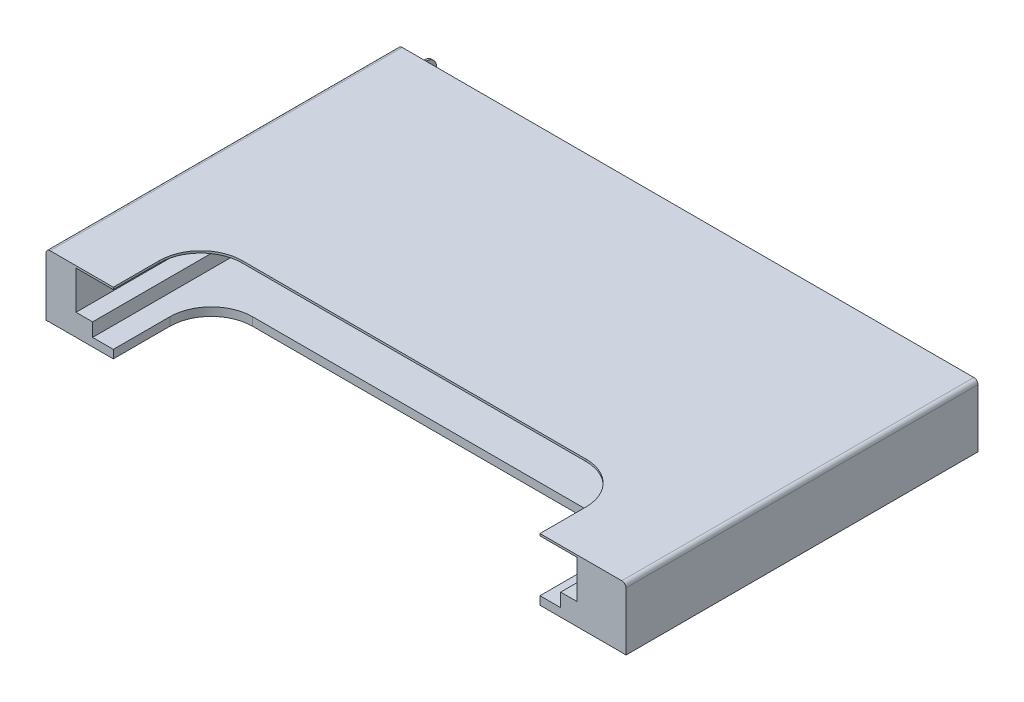
from build123d import *

# Parameters (mm, degrees)
SKETCH_5_W                          = 27.8
SKETCH_5_H                          = 2.9
EXTRUDE_2832_DEPTH                  = 29.2
CUT_EXTRUDE_3391_DEPTH              = 28
CUT_EXTRUDE_4027_DEPTH              = 0.5
SKETCH_41_W                         = 1.1
SKETCH_41_H                         = 2.9
CUT_EXTRUDE_4512_DEPTH              = 0.1
SKETCH_42_W                         = 1.1
SKETCH_42_H                         = 0.9
CUT_EXTRUDE_4964_DEPTH              = 0.1
SKETCH_13_R                         = 0.75
EXTRUDE_5511_DEPTH                  = 0.8
SKETCH_72_W                         = 1.1
SKETCH_72_H                         = 2.9
CUT_EXTRUDE_10_DEPTH                = 0.1
SKETCH_73_W                         = 0.8
SKETCH_73_H                         = 1.1
CUT_EXTRUDE_11_DEPTH                = 0.1
EXTRUDE_14_DEPTH                    = 0.5
EXTRUDE_14_DEPTH_BACK               = 0.5
SKETCH_74_W                         = 0.5
SKETCH_74_H                         = 1
FILLET_1_R                          = 0.3
CHAMFER_1_SIZE                      = 0.5
CHAMFER_2_SIZE                      = 0.35
CHAMFER_7286_SIZE                   = 0.3
SKETCH_30_W                         = 27.8
SKETCH_30_H                         = 27.01
SM_BASE_FLANGE_7820_DEPTH           = 0.1
SM_EDGE_FLANGE_7875_STRIP_W         = 0.6
SM_EDGE_FLANGE_7875_STRIP_H         = 0.1
SM_EDGE_FLANGE_7875_STRIP_CUT_DEPTH = 27.01
SM_EDGE_FLANGE_7875_DEPTH           = 27.01
SM_EDGE_FLANGE_8109_STRIP_W         = 0.6
SM_EDGE_FLANGE_8109_STRIP_H         = 0.1
SM_EDGE_FLANGE_8109_STRIP_CUT_DEPTH = 27.01
SM_EDGE_FLANGE_8109_DEPTH           = 27.01
CUT_EXTRUDE_8688_DEPTH              = 0.1
EXTRUDE_8998_DEPTH                  = 0.3
FILLET_9596_R                       = 0.3
PATTERN_LINEAR_1_COUNT              = 6
PATTERN_LINEAR_1_PITCH              = 2.5
FILLET_9596_OF_PATTERN_LINEAR_1_R   = 0.3
PATTERN_LINEAR_2_COUNT              = 2
PATTERN_LINEAR_2_PITCH              = 2.42
FILLET_9596_OF_PATTERN_LINEAR_2_R   = 0.3
PATTERN_LINEAR_3_COUNT              = 2
PATTERN_LINEAR_3_PITCH              = 4.12
FILLET_9596_OF_PATTERN_LINEAR_3_R   = 0.3
PATTERN_LINEAR_4_COUNT              = 2
PATTERN_LINEAR_4_PITCH              = 5.42
FILLET_9596_OF_PATTERN_LINEAR_4_R   = 0.3
CD_DEPTH                            = 0.1
GND_DEPTH                           = 0.05
GND_DEPTH_BACK                      = 0.05
SM_BASE_FLANGE_4_DEPTH              = 0.1
SM_START                            = 12.7
SM_EDGE_FLANGE_3_DEPTH              = 1
SM_EDGE_FLANGE_4_DEPTH              = 1
SM_BASE_FLANGE_5_DEPTH              = 0.1
SM_EDGE_FLANGE_5_STRIP_W            = 0.5
SM_EDGE_FLANGE_5_STRIP_H            = 0.1
SM_EDGE_FLANGE_5_STRIP_CUT_DEPTH    = 1
SM_EDGE_FLANGE_5_DEPTH              = 1
SM_EDGE_FLANGE_6_STRIP_W            = 0.5
SM_EDGE_FLANGE_6_STRIP_H            = 0.1
SM_EDGE_FLANGE_6_STRIP_CUT_DEPTH    = 1
SM_EDGE_FLANGE_6_DEPTH              = 1
SKETCH1_W                           = 36.262590985
SKETCH1_H                           = 21.311393531
CUT_EXTRUDE1_DEPTH                  = 33.800647859


# Read off the part's stored shape, not the designer's step: Ребро-кромка3, Ребро-кромка4
# Sheet-metal steps are written as plain solids
with BuildPart() as part:
    # Sketch 5 → Extrude 2832 (new body)
    with BuildSketch(Plane.XY):
        with Locations((0.45, 1.45)):
            Rectangle(SKETCH_5_W, SKETCH_5_H)
    extrude(amount=EXTRUDE_2832_DEPTH)

    # Sketch 6 → Cut-Extrude 3391 (cut)
    with BuildSketch(Plane.XY.offset(29.2)):
        Polygon((-12.1, 1.05), (-12.1, 2.9), (12.1, 2.9), (12.1, 1.05), (11.3, 1.05), (11.3, 0.4), (-11.3, 0.4), (-11.3, 1.05), align=None)
    extrude(amount=-CUT_EXTRUDE_3391_DEPTH, mode=Mode.SUBTRACT)

    # Эскиз39 → Cut-Extrude 4027 (cut)
    with BuildSketch(Plane(origin=(0, 0, 0), x_dir=(-1, 0, 0), z_dir=(0, -1, 0))):
        with BuildLine():
            Line((-10.3, -29.2), (10.3, -29.2))
            Line((10.3, -29.2), (10.3, -14.26169508))
            ThreePointArc((10.3, -14.26169508), (9.714213562, -12.847481517), (8.3, -12.26169508))
            Line((8.3, -12.26169508), (-8.3, -12.26169508))
            ThreePointArc((-8.3, -12.26169508), (-9.714213562, -12.847481517), (-10.3, -14.26169508))
            Line((-10.3, -14.26169508), (-10.3, -29.2))
        make_face()
    extrude(amount=-CUT_EXTRUDE_4027_DEPTH, mode=Mode.SUBTRACT)

    # Эскиз41 → Cut-Extrude 4512 (cut)
    with BuildSketch(Plane.XY.offset(29.2)):
        with Locations((13.2, 1.45)):
            Rectangle(SKETCH_41_W, SKETCH_41_H)
    extrude(amount=-CUT_EXTRUDE_4512_DEPTH, mode=Mode.SUBTRACT)

    # Эскиз42 → Cut-Extrude 4964 (cut)
    with BuildSketch(Plane(origin=(0, 2.9, 0), x_dir=(-1, 0, 0), z_dir=(0, 1, 0))):
        with Locations((-13.2, 28.65)):
            Rectangle(SKETCH_42_W, SKETCH_42_H)
    extrude(amount=-CUT_EXTRUDE_4964_DEPTH, mode=Mode.SUBTRACT)

    # Эскиз13 → Extrude 5511 (add)
    with BuildSketch(Plane.XZ):
        with Locations(Location((-12.1, 8.1, 0), (0, 0, 90))):
            Circle(SKETCH_13_R)
        with Locations(Location((13.1, 8.1, 0), (0, 0, 90))):
            Circle(SKETCH_13_R)
    extrude(amount=EXTRUDE_5511_DEPTH)

    # Эскиз72 → Вырез-Вытянуть10 (cut)
    with BuildSketch(Plane.ZY.offset(13.45)):
        with Locations((28.05, 1.45)):
            Rectangle(SKETCH_72_W, SKETCH_72_H)
    extrude(amount=-CUT_EXTRUDE_10_DEPTH, mode=Mode.SUBTRACT)

    # Эскиз73 → Вырез-Вытянуть11 (cut)
    with BuildSketch(Plane(origin=(0, 2.9, 0), x_dir=(-1, 0, 0), z_dir=(0, 1, 0))):
        with Locations((12.95, 28.05)):
            Rectangle(SKETCH_73_W, SKETCH_73_H)
    extrude(amount=-CUT_EXTRUDE_11_DEPTH, mode=Mode.SUBTRACT)

    # Эскиз74 → Бобышка-Вытянуть14 (add, two sides: drawn at the far end of the back side and taken through both)
    with BuildSketch(Plane.XY.offset(21.5).offset(-EXTRUDE_14_DEPTH_BACK)):
        with Locations((-13.7, 0.5)):
            Rectangle(SKETCH_74_W, SKETCH_74_H)
    extrude(amount=EXTRUDE_14_DEPTH + EXTRUDE_14_DEPTH_BACK)

    # Скругление1
    fillet_1_edges = [part.edges().sort_by_distance(p)[0] for p in [
        (-13.7, 1, 21),
        (-13.7, 1, 22),
    ]]
    fillet(fillet_1_edges, radius=FILLET_1_R)

    # Фаска_пластик1
    chamfer_1_edges = [part.edges().sort_by_distance(p)[0] for p in [
        (-11.7, 1.05, 29.2),
        (-11.3, 0.725, 29.2),
        (11.3, 0.725, 29.2),
        (11.7, 1.05, 29.2),
        (12.1, 1.975, 29.2),
        (-12.1, 1.975, 29.2),
    ]]
    chamfer(chamfer_1_edges, length=CHAMFER_1_SIZE)

    # Фаска_пластик_2
    chamfer_2_edges = [part.edges().sort_by_distance(p)[0] for p in [
        (-10.3, 0.2, 29.2),
        (-11.05, 0.4, 29.2),
        (10.3, 0.2, 29.2),
    ]]
    chamfer(chamfer_2_edges, length=CHAMFER_2_SIZE)

    # Chamfer 7286
    chamfer_7286_edges = [part.edges().sort_by_distance(p)[0] for p in [
        (-12.1, -0.8, 7.35),
        (13.1, -0.8, 7.35),
    ]]
    chamfer(chamfer_7286_edges, length=CHAMFER_7286_SIZE)

    # Эскиз14 → Extrude 8998 (add, symmetric)
    with BuildSketch(Plane(origin=(-5.63, 0, 0), x_dir=(0, 0, -1), z_dir=(1, 0, 0))):
        with BuildLine():
            Line((0, 0.326932693), (0.817714751, 0.326932693))
            ThreePointArc((0.817714751, 0.326932693), (0.87902999, 0.305929158), (0.914588493, 0.251741522))
            Line((0.914588493, 0.251741522), (0.966155464, 0.050382342))
            ThreePointArc((0.966155464, 0.050382342), (1.037272471, -0.05799293), (1.159902949, -0.1))
            Line((1.159902949, -0.1), (1.9, -0.1))
            Line((1.9, -0.1), (1.9, 0))
            Line((1.9, 0), (1.159902949, 0))
            ThreePointArc((1.159902949, 0), (1.09858771, 0.021003535), (1.063029207, 0.075191171))
            Line((1.063029207, 0.075191171), (1.011462236, 0.276550351))
            ThreePointArc((1.011462236, 0.276550351), (0.940345229, 0.384925623), (0.817714751, 0.426932693))
            Line((0.817714751, 0.426932693), (0, 0.426932693))
            Line((0, 0.426932693), (0, 0.326932693))
        make_face()
    extrude_8998 = extrude(amount=EXTRUDE_8998_DEPTH, both=True)

    # Fillet 9596
    fillet_9596_edges = [part.edges().sort_by_distance(p)[0] for p in [
        (-5.93, -0.05, -1.9),
        (-5.33, -0.05, -1.9),
    ]]
    fillet(fillet_9596_edges, radius=FILLET_9596_R - 0.0001)  # a hair under: the kernel refuses the full size

    # Линейный массив1: Extrude 8998 ×6
    with Locations(*[(i * PATTERN_LINEAR_1_PITCH, 0, 0) for i in range(1, PATTERN_LINEAR_1_COUNT)]):
        add(extrude_8998)

    # Fillet 9596 of Линейный массив1
    fillet_9596_of_pattern_linear_1_edges = [part.edges().sort_by_distance(p)[0] for p in [
        (-3.43, -0.05, -1.9),
        (-2.83, -0.05, -1.9),
        (-0.93, -0.05, -1.9),
        (-0.33, -0.05, -1.9),
        (1.57, -0.05, -1.9),
        (2.17, -0.05, -1.9),
        (4.07, -0.05, -1.9),
        (4.67, -0.05, -1.9),
        (6.57, -0.05, -1.9),
        (7.17, -0.05, -1.9),
    ]]
    fillet(fillet_9596_of_pattern_linear_1_edges, radius=FILLET_9596_OF_PATTERN_LINEAR_1_R - 0.0001)  # a hair under: the kernel refuses the full size

    # Линейный массив2: Extrude 8998 ×2
    with Locations(*[(-i * PATTERN_LINEAR_2_PITCH, 0, 0) for i in range(1, PATTERN_LINEAR_2_COUNT)]):
        add(extrude_8998)

    # Fillet 9596 of Линейный массив2
    fillet_9596_of_pattern_linear_2_edges = [part.edges().sort_by_distance(p)[0] for p in [
        (-8.35, -0.05, -1.9),
        (-7.75, -0.05, -1.9),
    ]]
    fillet(fillet_9596_of_pattern_linear_2_edges, radius=FILLET_9596_OF_PATTERN_LINEAR_2_R - 0.0001)  # a hair under: the kernel refuses the full size

    # Линейный массив3: Extrude 8998 ×2
    with Locations(*[(-i * PATTERN_LINEAR_3_PITCH, 0, 0) for i in range(1, PATTERN_LINEAR_3_COUNT)]):
        add(extrude_8998)

    # Fillet 9596 of Линейный массив3
    fillet_9596_of_pattern_linear_3_edges = [part.edges().sort_by_distance(p)[0] for p in [
        (-10.05, -0.05, -1.9),
        (-9.45, -0.05, -1.9),
    ]]
    fillet(fillet_9596_of_pattern_linear_3_edges, radius=FILLET_9596_OF_PATTERN_LINEAR_3_R - 0.0001)  # a hair under: the kernel refuses the full size

    # Линейный массив4: Extrude 8998 ×2
    with Locations(*[(-i * PATTERN_LINEAR_4_PITCH, 0, 0) for i in range(1, PATTERN_LINEAR_4_COUNT)]):
        add(extrude_8998)

    # Fillet 9596 of Линейный массив4
    fillet_9596_of_pattern_linear_4_edges = [part.edges().sort_by_distance(p)[0] for p in [
        (-11.35, -0.05, -1.9),
        (-10.75, -0.05, -1.9),
    ]]
    fillet(fillet_9596_of_pattern_linear_4_edges, radius=FILLET_9596_OF_PATTERN_LINEAR_4_R - 0.0001)  # a hair under: the kernel refuses the full size

    # Эскиз20 → Вывод_CD (add)
    with BuildSketch(Plane(origin=(-12.85, 0, 0), x_dir=(0, 0, -1), z_dir=(1, 0, 0))):
        with BuildLine():
            Line((0, 2.447952467), (0.57433497, 2.447952467))
            ThreePointArc((0.57433497, 2.447952467), (0.927888361, 2.301505858), (1.07433497, 1.947952467))
            Line((1.07433497, 1.947952467), (1.07433497, 0.5))
            ThreePointArc((1.07433497, 0.5), (1.132913614, 0.358578644), (1.27433497, 0.3))
            Line((1.27433497, 0.3), (1.7, 0.3))
            ThreePointArc((1.7, 0.3), (1.841421356, 0.241421356), (1.9, 0.1))
            Line((1.9, 0.1), (1.9, -0.1))
            Line((1.9, -0.1), (1.07433497, -0.1))
            ThreePointArc((1.07433497, -0.1), (0.72078158, 0.046446609), (0.57433497, 0.4))
            Line((0.57433497, 0.4), (0.57433497, 1.747952467))
            ThreePointArc((0.57433497, 1.747952467), (0.515756326, 1.889373823), (0.37433497, 1.947952467))
            Line((0.37433497, 1.947952467), (0, 1.947952467))
            Line((0, 1.947952467), (0, 2.447952467))
        make_face()
    extrude(amount=CD_DEPTH)



with BuildPart() as body_2:
    # Эскиз30 → Sm Base Flange 7820 (new body)
    with BuildSketch(Plane(origin=(0, 2.9, 0), x_dir=(1, 0, 0), z_dir=(0, 1, 0))):
        with Locations((0.45, -13.495)):
            Rectangle(SKETCH_30_W, SKETCH_30_H)
    extrude(amount=SM_BASE_FLANGE_7820_DEPTH)

    # Sm Edge Flange 7875 strip (across the edge) → Sm Edge Flange 7875 strip cut (cut)
    with BuildSketch(Plane(origin=(-13.45, 2.9, 27), x_dir=(1, 0, 0), z_dir=(0, 0, -1))):
        with Locations((-0.2, -0.05)):
            Rectangle(SM_EDGE_FLANGE_7875_STRIP_W, SM_EDGE_FLANGE_7875_STRIP_H)
    extrude(amount=SM_EDGE_FLANGE_7875_STRIP_CUT_DEPTH, mode=Mode.SUBTRACT)

    # Sm Edge Flange 7875 section (across the edge) → Sm Edge Flange 7875 (add)
    with BuildSketch(Plane(origin=(-13.45, 2.9, 27), x_dir=(1, 0, 0), z_dir=(0, 0, -1))):
        with BuildLine():
            Line((-0.1, 0.1), (-0.1, 2.91))
            Line((-0.1, 2.91), (0, 2.91))
            Line((0, 2.91), (0, 0.1))
            ThreePointArc((0, 0.1), (0.029289322, 0.029289322), (0.1, 0))
            Line((0.1, 0), (0.1, -0.1))
            ThreePointArc((0.1, -0.1), (-0.041421356, -0.041421356), (-0.1, 0.1))
        make_face()
    extrude(amount=SM_EDGE_FLANGE_7875_DEPTH)

    # Sm Edge Flange 8109 strip (across the edge) → Sm Edge Flange 8109 strip cut (cut)
    with BuildSketch(Plane(origin=(14.35, 2.9, -0.01), x_dir=(-1, 0, 0), z_dir=(0, 0, 1))):
        with Locations((-0.2, -0.05)):
            Rectangle(SM_EDGE_FLANGE_8109_STRIP_W, SM_EDGE_FLANGE_8109_STRIP_H)
    extrude(amount=SM_EDGE_FLANGE_8109_STRIP_CUT_DEPTH, mode=Mode.SUBTRACT)

    # Sm Edge Flange 8109 section (across the edge) → Sm Edge Flange 8109 (add)
    with BuildSketch(Plane(origin=(14.35, 2.9, -0.01), x_dir=(-1, 0, 0), z_dir=(0, 0, 1))):
        with BuildLine():
            Line((-0.1, 0.1), (-0.1, 2.91))
            Line((-0.1, 2.91), (0, 2.91))
            Line((0, 2.91), (0, 0.1))
            ThreePointArc((0, 0.1), (0.029289322, 0.029289322), (0.1, 0))
            Line((0.1, 0), (0.1, -0.1))
            ThreePointArc((0.1, -0.1), (-0.041421356, -0.041421356), (-0.1, 0.1))
        make_face()
    extrude(amount=SM_EDGE_FLANGE_8109_DEPTH)

    # Эскиз8 → Cut-Extrude 8688 (cut)
    with BuildSketch(Plane(origin=(0, 3, 0), x_dir=(1, 0, 0), z_dir=(0, 1, 0))):
        with BuildLine():
            Line((-9.3, -25.76630709), (9.3, -25.76630709))
            ThreePointArc((9.3, -25.76630709), (10.007106781, -25.473413871), (10.3, -24.76630709))
            Line((10.3, -24.76630709), (10.3, -14.76630709))
            ThreePointArc((10.3, -14.76630709), (9.714213562, -13.352093528), (8.3, -12.76630709))
            Line((8.3, -12.76630709), (-8.3, -12.76630709))
            ThreePointArc((-8.3, -12.76630709), (-9.714213562, -13.352093528), (-10.3, -14.76630709))
            Line((-10.3, -14.76630709), (-10.3, -24.76630709))
            ThreePointArc((-10.3, -24.76630709), (-10.007106781, -25.473413871), (-9.3, -25.76630709))
        make_face()
    extrude(amount=-CUT_EXTRUDE_8688_DEPTH, mode=Mode.SUBTRACT)


with BuildPart() as part_1:
    add(part.part)

    add(body_2.part)  # Вывод_GND merges body 2
    # Эскиз71 → Вывод_GND (add, two sides: drawn at the far end of the back side and taken through both)
    with BuildSketch(Plane.XY.offset(21.5).offset(-GND_DEPTH_BACK)):
        with BuildLine():
            Line((-13.55, -0.1), (-14.399652774, -0.1))
            Line((-14.399652774, -0.1), (-14.399652774, 0))
            ThreePointArc((-14.399652774, 0), (-14.370363452, 0.070710678), (-14.299652774, 0.1))
            Line((-14.299652774, 0.1), (-14.15, 0.1))
            ThreePointArc((-14.15, 0.1), (-14.079289322, 0.129289322), (-14.05, 0.2))
            Line((-14.05, 0.2), (-14.05, 1))
            ThreePointArc((-14.05, 1), (-14.020710678, 1.070710678), (-13.95, 1.1))
            Line((-13.95, 1.1), (-13.55, 1.1))
            Line((-13.55, 1.1), (-13.55, -0.1))
        make_face()
    extrude(amount=GND_DEPTH + GND_DEPTH_BACK)


with BuildPart() as body_2_2:
    # Эскиз28 → Базовая кромка4 (new body)
    with BuildSketch(Plane.XY.offset(29.2)):
        with BuildLine():
            Line((13.7, 2.8), (12.7, 2.8))
            Line((12.7, 2.8), (12.7, 0.437580966))
            Line((12.7, 0.437580966), (12.75, 0.437580966))
            ThreePointArc((12.75, 0.437580966), (12.820710678, 0.408291644), (12.85, 0.337580966))
            Line((12.85, 0.337580966), (12.85, -0.8))
            Line((12.85, -0.8), (13.55, -0.8))
            Line((13.55, -0.8), (13.55, 0.337580966))
            ThreePointArc((13.55, 0.337580966), (13.579289322, 0.408291644), (13.65, 0.437580966))
            Line((13.65, 0.437580966), (13.7, 0.437580966))
            Line((13.7, 0.437580966), (13.7, 2.8))
        make_face()
    extrude(amount=-SM_BASE_FLANGE_4_DEPTH)

    # Ребро-кромка3 outline → Ребро-кромка3 (add)
    with BuildSketch(Plane.YZ.offset(SM_START)):
        with BuildLine():
            Line((2.9, 28.5), (2.9, 29.1))
            ThreePointArc((2.9, 29.1), (2.870710678, 29.170710678), (2.8, 29.2))
            Line((2.8, 29.2), (2.8, 28.5))
            Line((2.8, 28.5), (2.9, 28.5))
        make_face()
    extrude(amount=SM_EDGE_FLANGE_3_DEPTH)

    # Ребро-кромка4 outline → Ребро-кромка4 (add)
    with BuildSketch(Plane.YZ.offset(SM_START)):
        with BuildLine():
            ThreePointArc((2.8, 28.4), (2.870710678, 28.429289322), (2.9, 28.5))
            Line((2.9, 28.5), (2.7, 28.5))
            Line((2.7, 28.5), (2.7, 28.4))
            Line((2.7, 28.4), (2.8, 28.4))
        make_face()
    extrude(amount=SM_EDGE_FLANGE_4_DEPTH)


with BuildPart() as body_3:
    # Эскиз59 → Базовая кромка5 (new body)
    with BuildSketch(Plane.ZY.offset(13.45)):
        with BuildLine():
            Line((28.55, 2.8), (27.55, 2.8))
            Line((27.55, 2.8), (27.55, 0.555707004))
            Line((27.55, 0.555707004), (27.6, 0.555707004))
            ThreePointArc((27.6, 0.555707004), (27.670710678, 0.526417682), (27.7, 0.455707004))
            Line((27.7, 0.455707004), (27.7, -0.681873961))
            Line((27.7, -0.681873961), (28.4, -0.681873961))
            Line((28.4, -0.681873961), (28.4, 0.455707004))
            ThreePointArc((28.4, 0.455707004), (28.429289322, 0.526417682), (28.5, 0.555707004))
            Line((28.5, 0.555707004), (28.55, 0.555707004))
            Line((28.55, 0.555707004), (28.55, 2.8))
        make_face()
    extrude(amount=-SM_BASE_FLANGE_5_DEPTH)

    # Ребро-кромка5 strip (across the edge) → Ребро-кромка5 strip cut (cut)
    with BuildSketch(Plane(origin=(-13.35, 2.8, 27.55), x_dir=(0, -1, 0), z_dir=(0, 0, 1))):
        with Locations((-0.2, -0.05)):
            Rectangle(SM_EDGE_FLANGE_5_STRIP_W, SM_EDGE_FLANGE_5_STRIP_H)
    extrude(amount=SM_EDGE_FLANGE_5_STRIP_CUT_DEPTH, mode=Mode.SUBTRACT)

    # Ребро-кромка5 section (across the edge) → Ребро-кромка5 (add)
    with BuildSketch(Plane(origin=(-13.35, 2.8, 27.55), x_dir=(0, -1, 0), z_dir=(0, 0, 1))):
        with BuildLine():
            Line((-0.1, 0.05), (-0.1, 0.7))
            Line((-0.1, 0.7), (0, 0.7))
            Line((0, 0.7), (0, 0.05))
            ThreePointArc((0, 0.05), (0.014644661, 0.014644661), (0.05, 0))
            Line((0.05, 0), (0.05, -0.1))
            ThreePointArc((0.05, -0.1), (-0.056066017, -0.056066017), (-0.1, 0.05))
        make_face()
    extrude(amount=SM_EDGE_FLANGE_5_DEPTH)

    # Ребро-кромка6 strip (across the edge) → Ребро-кромка6 strip cut (cut)
    with BuildSketch(Plane(origin=(-12.65, 2.8, 27.55), x_dir=(-1, 0, 0), z_dir=(0, 0, 1))):
        with Locations((-0.2, -0.05)):
            Rectangle(SM_EDGE_FLANGE_6_STRIP_W, SM_EDGE_FLANGE_6_STRIP_H)
    extrude(amount=SM_EDGE_FLANGE_6_STRIP_CUT_DEPTH, mode=Mode.SUBTRACT)

    # Ребро-кромка6 section (across the edge) → Ребро-кромка6 (add)
    with BuildSketch(Plane(origin=(-12.65, 2.8, 27.55), x_dir=(-1, 0, 0), z_dir=(0, 0, 1))):
        with BuildLine():
            Line((-0.1, 0.05), (-0.1, 0.2))
            Line((-0.1, 0.2), (0, 0.2))
            Line((0, 0.2), (0, 0.05))
            ThreePointArc((0, 0.05), (0.014644661, 0.014644661), (0.05, 0))
            Line((0.05, 0), (0.05, -0.1))
            ThreePointArc((0.05, -0.1), (-0.056066017, -0.056066017), (-0.1, 0.05))
        make_face()
    extrude(amount=SM_EDGE_FLANGE_6_DEPTH)


with BuildPart() as cut_extrude1_tool:
    # Sketch1 → Cut-Extrude1 (new, through all)
    with BuildSketch(Plane(origin=(0, 3, 0), x_dir=(-1, 0, 0), z_dir=(0, 1, 0))):
        with Locations((-1.013134584, 27.645696766)):
            Rectangle(SKETCH1_W, SKETCH1_H)
    extrude(amount=-CUT_EXTRUDE1_DEPTH)


with BuildPart() as part_2:
    add(part_1.part)

    # Cut-Extrude1: cut by cut_extrude1_tool
    add(cut_extrude1_tool.part, mode=Mode.SUBTRACT)


with BuildPart() as body_2_2_1:
    add(body_2_2.part)

    # Cut-Extrude1: cut by cut_extrude1_tool
    add(cut_extrude1_tool.part, mode=Mode.SUBTRACT)


with BuildPart() as body_3_1:
    add(body_3.part)

    # Cut-Extrude1: cut by cut_extrude1_tool
    add(cut_extrude1_tool.part, mode=Mode.SUBTRACT)


solid = part_2.part
